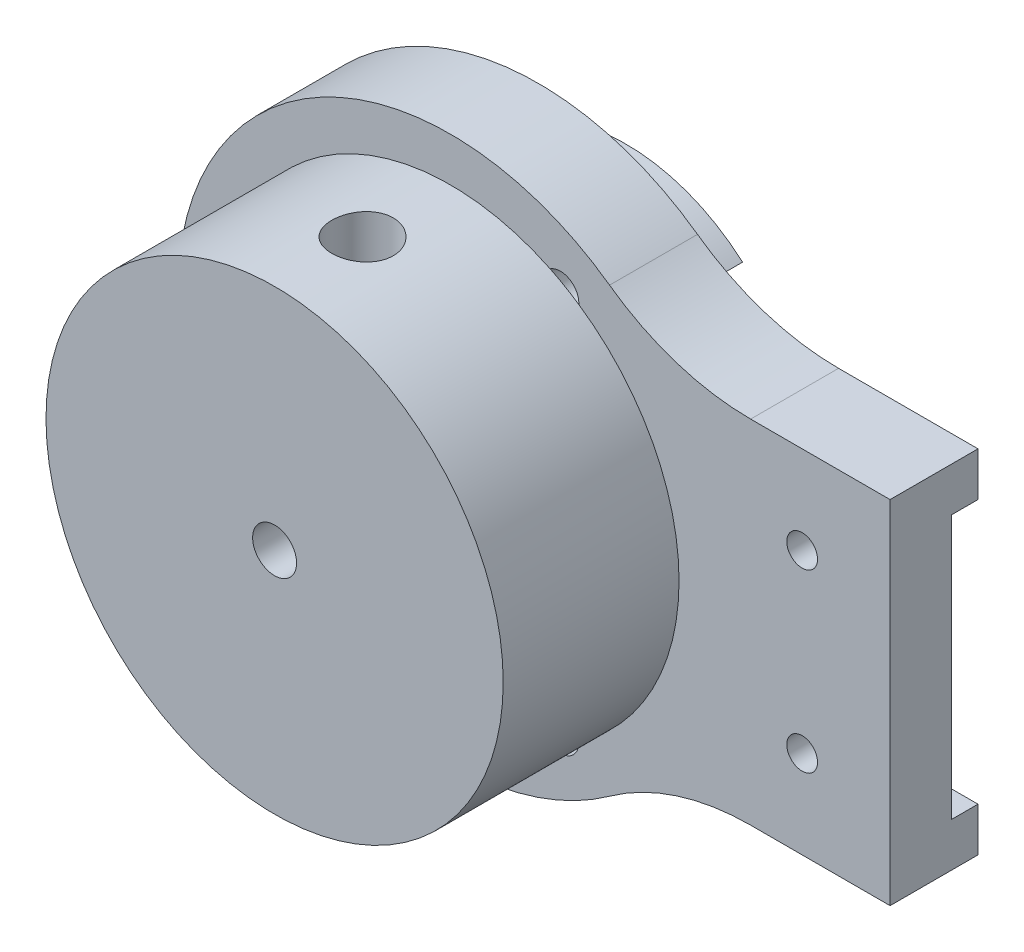
from build123d import *

# Parameters (mm, degrees)
SKETCH1_R                     = 26
BOSS_EXTRUDE1_DEPTH           = 20
SKETCH2_W                     = 2.1
SKETCH2_H                     = 26
SKETCH4_R                     = 3.5
CUT_EXTRUDE1_DEPTH            = 15
BOSS_EXTRUDE2_DEPTH           = 10
CUT_EXTRUDE2_DEPTH            = 3
SKETCH7_R                     = 2.4
BOSS_EXTRUDE3_DEPTH           = 3
SKETCH8_R                     = 0.75
CUT_EXTRUDE3_DEPTH            = 67.03786797
SKETCH9_R                     = 2.5
CUT_EXTRUDE4_DEPTH            = 14
SKETCH10_R                    = 1.75
CUT_EXTRUDE5_DEPTH            = 16
BOSS_EXTRUDE4_START           = 10
BOSS_EXTRUDE4_DEPTH           = 10
M5X0_8_START                  = -10
M5X0_8_TAPPED_HOLE2_OUTLINE_R = 2.1
M5X0_8_TAPPED_HOLE2_DEPTH     = 10
CIRPATTERN1_COUNT             = 3


# Read off the part's stored shape, not the designer's step: M5x0.8 Tapped Hole2
with BuildPart() as part:
    # Sketch1 → Boss-Extrude1 (new body)
    with BuildSketch(Plane.XY):
        Circle(SKETCH1_R)
    extrude(amount=BOSS_EXTRUDE1_DEPTH)

    # Sketch2 → M5x0.8 Tapped Hole1 (revolve, cut)
    with BuildSketch(Plane(origin=(0, 0, 10), x_dir=(0, 0, -1), z_dir=(1, 0, 0))):
        with Locations((1.05, 13)):
            Rectangle(SKETCH2_W, SKETCH2_H)
    revolve(axis=Axis((0, -6.35, 10), (0, 1, 0)), mode=Mode.SUBTRACT)

    # Sketch4 → Cut-Extrude1 (cut)
    with BuildSketch(Plane(origin=(0, 26, 0), x_dir=(-1, 0, 0), z_dir=(0, 1, 0))):
        with Locations(Location((0, 10, 0), (0, 0, 90))):
            Circle(SKETCH4_R)
    extrude(amount=-CUT_EXTRUDE1_DEPTH, mode=Mode.SUBTRACT)

    # Sketch5 → Boss-Extrude2 (add)
    with BuildSketch(Plane(origin=(0, 0, 0), x_dir=(-1, 0, 0), z_dir=(0, 0, -1))):
        with BuildLine():
            Line((-34.142470626, -20), (-50, -20))
            Line((-50, -20), (-50, 20))
            Line((-50, 20), (-34.142470626, 20))
            ThreePointArc((-34.142470626, 20), (-25.713473942, 21.324307139), (-18.096692901, 25.16961871))
            ThreePointArc((-18.096692901, 25.16961871), (31, 0), (-18.096692901, -25.16961871))
            ThreePointArc((-18.096692901, -25.16961871), (-25.713473942, -21.324307139), (-34.142470626, -20))
        make_face()
    extrude(amount=BOSS_EXTRUDE2_DEPTH)

    # Sketch6 → Cut-Extrude2 (cut)
    with BuildSketch(Plane(origin=(0, 0, -10), x_dir=(-1, 0, 0), z_dir=(0, 0, -1))):
        with BuildLine():
            Line((0, -15), (-80, -15))
            ThreePointArc((-80, -15), (-95, 0), (-80, 15))
            Line((-80, 15), (0, 15))
            ThreePointArc((0, 15), (15, 0), (0, -15))
        make_face()
    extrude(amount=-CUT_EXTRUDE2_DEPTH, mode=Mode.SUBTRACT)

    # Sketch7 → Boss-Extrude3 (add)
    with BuildSketch(Plane(origin=(0, 0, -7), x_dir=(-1, 0, 0), z_dir=(0, 0, -1))):
        with Locations(Location((0, 0, 0), (0, 0, 180))):
            Circle(SKETCH7_R)
    extrude(amount=BOSS_EXTRUDE3_DEPTH)

    # Sketch8 → Cut-Extrude3 (cut, through all)
    with BuildSketch(Plane(origin=(0, 0, -10), x_dir=(-1, 0, 0), z_dir=(0, 0, -1))):
        Circle(SKETCH8_R)
    extrude(amount=-CUT_EXTRUDE3_DEPTH, mode=Mode.SUBTRACT)

    # Sketch9 → Cut-Extrude4 (cut)
    with BuildSketch(Plane.XY.offset(20)):
        Circle(SKETCH9_R)
    extrude(amount=-CUT_EXTRUDE4_DEPTH, mode=Mode.SUBTRACT)

    # Sketch10 → Cut-Extrude5 (cut)
    with BuildSketch(Plane(origin=(0, 0, -7), x_dir=(-1, 0, 0), z_dir=(0, 0, -1))):
        with Locations((-40, -10)):
            Circle(SKETCH10_R)
        with Locations((-40, 10)):
            Circle(SKETCH10_R)
    extrude(amount=-CUT_EXTRUDE5_DEPTH, mode=Mode.SUBTRACT)

    # Sketch11 → Boss-Extrude4 (add)
    with BuildSketch(Plane(origin=(0, 0, -10), x_dir=(-1, 0, 0), z_dir=(0, 0, -1)).offset(BOSS_EXTRUDE4_START)):
        with BuildLine():
            Line((0, 15), (-13.228756555, 15))
            ThreePointArc((-13.228756555, 15), (20, 0), (-13.228756555, -15))
            Line((-13.228756555, -15), (0, -15))
            ThreePointArc((0, -15), (15, 0), (0, 15))
        make_face()
    extrude(amount=-BOSS_EXTRUDE4_DEPTH)

    # M5x0.8 Tapped Hole2 outline → M5x0.8 Tapped Hole2 (cut)
    with BuildSketch(Plane.XY.offset(M5X0_8_START)):
        with Locations((-25, 0)):
            Circle(M5X0_8_TAPPED_HOLE2_OUTLINE_R)
    m5x0_8_tapped_hole2 = extrude(amount=M5X0_8_TAPPED_HOLE2_DEPTH, mode=Mode.SUBTRACT)

    # CirPattern1: M5x0.8 Tapped Hole2 ×3 about axis
    cirpattern1_axis = Axis((0, 0, 0), (0, 0, 1))
    for i in range(1, CIRPATTERN1_COUNT):
        add(m5x0_8_tapped_hole2.rotate(cirpattern1_axis, i * 360 / CIRPATTERN1_COUNT), mode=Mode.SUBTRACT)


solid = part.part
